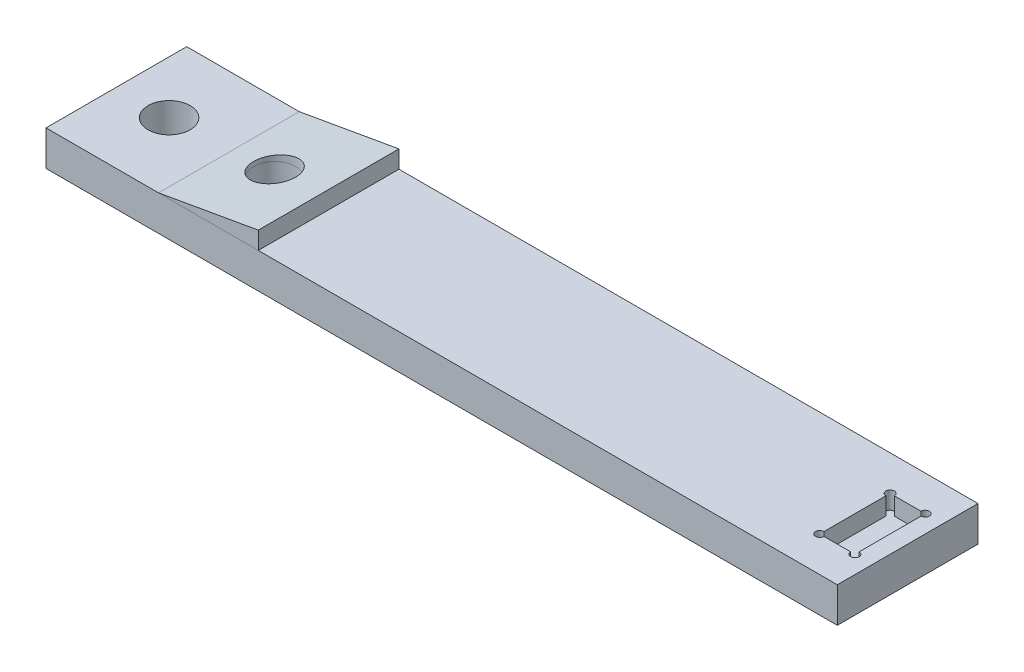
from build123d import *

# Parameters (mm, degrees)
SKETCH1_W                      = 71.4375
SKETCH1_H                      = 12.7
BOSS_EXTRUDE1_DEPTH            = 3.175
BOSS_EXTRUDE2_DEPTH            = 12.7
CUT_EXTRUDE1_DEPTH             = 1.5875
SKETCH5_W                      = 1.89865
SKETCH5_H                      = 4.7625
F_6_CLEARANCE_HOLE2_AT_2_COUNT = 2
F_6_CLEARANCE_HOLE2_AT_2_PITCH = 9.525


with BuildPart() as part:
    # Sketch1 → Boss-Extrude1 (new body)
    with BuildSketch(Plane(origin=(0, 0, 0), x_dir=(1, 0, 0), z_dir=(0, 1, 0))):
        Rectangle(SKETCH1_W, SKETCH1_H)
    extrude(amount=BOSS_EXTRUDE1_DEPTH)

    # Sketch3 → Cut-Extrude1 (cut)
    with BuildSketch(Plane(origin=(0, 3.175, 0), x_dir=(1, 0, 0), z_dir=(0, 1, 0))):
        with BuildLine():
            ThreePointArc((30.95625, -2.794), (30.686842316, -3.444407684), (31.33725, -3.175))
            Line((31.33725, -3.175), (33.75025, -3.175))
            ThreePointArc((33.75025, -3.175), (34.400657684, -3.444407684), (34.13125, -2.794))
            Line((34.13125, -2.794), (34.13125, 2.794))
            ThreePointArc((34.13125, 2.794), (34.400657684, 3.444407684), (33.75025, 3.175))
            Line((33.75025, 3.175), (31.33725, 3.175))
            ThreePointArc((31.33725, 3.175), (30.686842316, 3.444407684), (30.95625, 2.794))
            Line((30.95625, 2.794), (30.95625, -2.794))
        make_face()
    extrude(amount=-CUT_EXTRUDE1_DEPTH, mode=Mode.SUBTRACT)

    # Sketch5 → #6 Clearance Hole2 (revolve, cut)
    with BuildSketch(Plane(origin=(-30.95625, 0, 0), x_dir=(0, 0, -1), z_dir=(1, 0, 0))):
        with Locations((0.949325, 2.38125)):
            Rectangle(SKETCH5_W, SKETCH5_H)
    f_6_clearance_hole2 = revolve(axis=Axis((-30.95625, -6.35, 0), (0, 1, 0)), mode=Mode.SUBTRACT)


with BuildPart() as body_2:
    # Sketch2 → Boss-Extrude2 (new body)
    with BuildSketch(Plane.XY.offset(6.35)):
        Polygon((-25.55875, 3.175), (-16.555590111, 4.7625), (-16.555590111, 3.175), align=None)
    extrude(amount=-BOSS_EXTRUDE2_DEPTH)


with BuildPart() as f_6_clearance_hole2_at_2_tool:
    # #6 Clearance Hole2 at 2: #6 Clearance Hole2 ×2
    with Locations(*[(i * F_6_CLEARANCE_HOLE2_AT_2_PITCH, 0, 0) for i in range(1, F_6_CLEARANCE_HOLE2_AT_2_COUNT)]):
        add(f_6_clearance_hole2)


with BuildPart() as part_1:
    add(part.part)

    # #6 Clearance Hole2 at 2: cut by f_6_clearance_hole2_at_2_tool
    add(f_6_clearance_hole2_at_2_tool.part, mode=Mode.SUBTRACT)


with BuildPart() as body_2_1:
    add(body_2.part)

    # #6 Clearance Hole2 at 2: cut by f_6_clearance_hole2_at_2_tool
    add(f_6_clearance_hole2_at_2_tool.part, mode=Mode.SUBTRACT)


solid = Compound([part_1.part, body_2_1.part])
